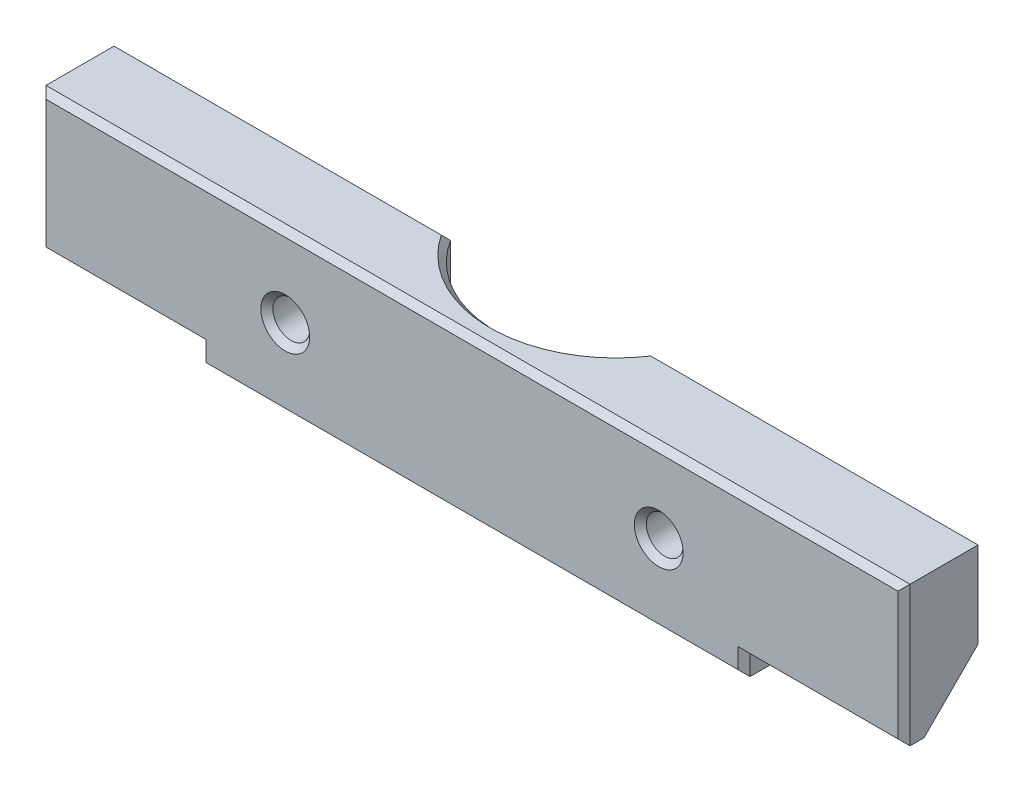
from build123d import *

# Parameters (mm, degrees)
SKIZZE1_W                       = 68
SKIZZE1_H                       = 20
AUFSATZ_LINEAR_AUSTRAGEN1_DEPTH = 10
AUFSATZ_LINEAR_AUSTRAGEN2_DEPTH = 20
SKIZZE3_R                       = 15
SCHNITT_LINEAR_AUSTRAGEN1_DEPTH = 20
SKIZZE4_R                       = 2.3
SCHNITT_LINEAR_AUSTRAGEN2_DEPTH = 20
SKIZZE5_R                       = 3.75
SCHNITT_LINEAR_AUSTRAGEN3_DEPTH = 3
SCHNITT_LINEAR_AUSTRAGEN4_DEPTH = 20
FASE3_SIZE                      = 0.75


with BuildPart() as part:
    # Skizze1 → Aufsatz-Linear austragen1 (new body)
    with BuildSketch(Plane.XY):
        with Locations((0, 10)):
            Rectangle(SKIZZE1_W, SKIZZE1_H)
    extrude(amount=AUFSATZ_LINEAR_AUSTRAGEN1_DEPTH)

    # Skizze2 → Aufsatz-Linear austragen2 (add)
    with BuildSketch(Plane.ZY.offset(34)):
        Polygon((10, 0), (0, 10), (0, 20), (10, 20), align=None)
    aufsatz_linear_austragen2 = extrude(amount=AUFSATZ_LINEAR_AUSTRAGEN2_DEPTH)

    # Spiegeln1: Aufsatz-Linear austragen2 across plane
    add(aufsatz_linear_austragen2.mirror(Plane(origin=(0, 0, 0), x_dir=(0, 0, 1), z_dir=(1, 0, 0))))

    # Skizze3 → Schnitt-Linear austragen1 (cut)
    with BuildSketch(Plane.XZ):
        with Locations((0, -8)):
            Circle(SKIZZE3_R)
    extrude(amount=-SCHNITT_LINEAR_AUSTRAGEN1_DEPTH, mode=Mode.SUBTRACT)

    # Skizze4 → Schnitt-Linear austragen2 (cut)
    with BuildSketch(Plane(origin=(0, 0, 0), x_dir=(-1, 0, 0), z_dir=(0, 0, -1))):
        with Locations((-23.34428877, 10)):
            Circle(SKIZZE4_R)
        with Locations((23.34428877, 10)):
            Circle(SKIZZE4_R)
    extrude(amount=-SCHNITT_LINEAR_AUSTRAGEN2_DEPTH, mode=Mode.SUBTRACT)

    # Skizze5 → Schnitt-Linear austragen3 (cut)
    with BuildSketch(Plane(origin=(0, 0, 0), x_dir=(-1, 0, 0), z_dir=(0, 0, -1))):
        with Locations((-23.34428877, 10)):
            Circle(SKIZZE5_R)
        with Locations((23.34428877, 10)):
            Circle(SKIZZE5_R)
    extrude(amount=-SCHNITT_LINEAR_AUSTRAGEN3_DEPTH, mode=Mode.SUBTRACT)

    # Skizze6 → Schnitt-Linear austragen4 (cut)
    with BuildSketch(Plane.ZY.offset(54)):
        Polygon((10, 2.5), (4.852604626, 2.5), (4.852604626, -2.668604054), (13.586779437, -2.788104879), (13.586779437, 2.151024835), align=None)
    schnitt_linear_austragen4 = extrude(amount=-SCHNITT_LINEAR_AUSTRAGEN4_DEPTH, mode=Mode.SUBTRACT)

    # Spiegeln3: Schnitt-Linear austragen4 across plane
    add(schnitt_linear_austragen4.mirror(Plane(origin=(0, 0, 0), x_dir=(0, 0, 1), z_dir=(1, 0, 0))), mode=Mode.SUBTRACT)

    # Fase3
    fase3_edges = [part.edges().sort_by_distance(p)[0] for p in [
        (0, 0, 10),
        (-34, 1.25, 10),
        (-44, 2.5, 10),
        (-54, 11.25, 10),
        (0, 20, 10),
        (54, 11.25, 10),
        (44, 2.5, 10),
        (34, 1.25, 10),
        (-21.04428877, 10, 10),
        (25.64428877, 10, 10),
        (-19.59428877, 10, 0),
        (27.09428877, 10, 0),
        (54, 15, 0),
        (33.34428877, 20, 0),
        (0, 20, 7),
        (-33.34428877, 20, 0),
        (-54, 15, 0),
        (34, 5, 0),
        (23.34428877, 0, 0),
        (0, 0, 7),
        (-34, 5, 0),
        (-23.34428877, 0, 0),
    ]]
    chamfer(fase3_edges, length=FASE3_SIZE)


solid = part.part
